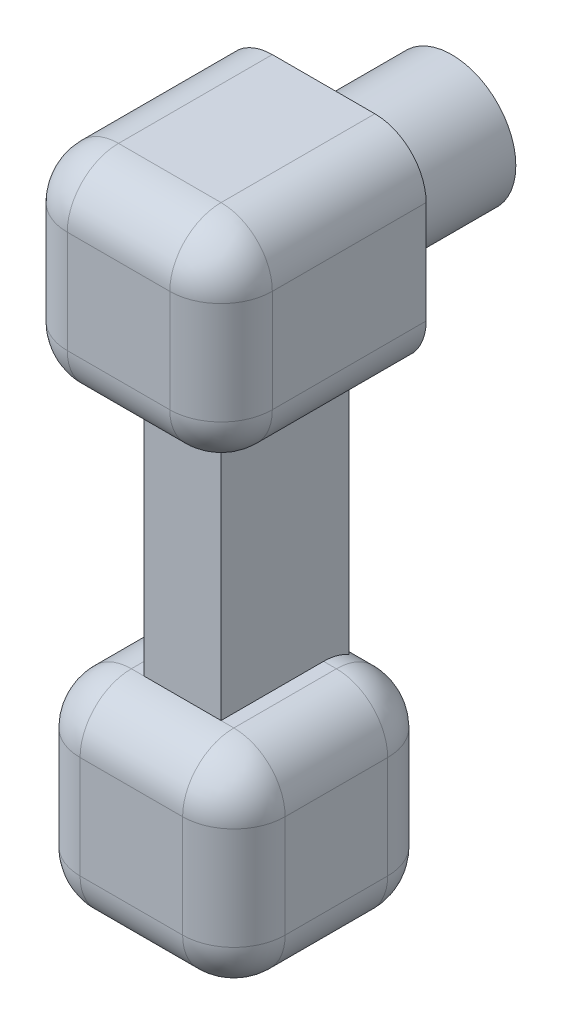
from build123d import *

# Parameters (mm, degrees)
ESQUISSE1_R             = 12.5
BOSS_EXTRU_1_DEPTH      = 25
BOSS_EXTRU_2_DEPTH      = 40
CONG_1_R                = 10
ESQUISSE5_W             = 15
ESQUISSE5_H             = 25
BOSS_EXTRU_3_DEPTH      = 50
BOSS_EXTRU_4_DEPTH      = 5
BOSS_EXTRU_4_DEPTH_BACK = 35
ESQUISSE6_W             = 40
ESQUISSE6_H             = 40
CONG_2_R                = 10
CONG_3_R                = 10
ESQUISSE8_R             = 7.5
ENL_V_MAT_EXTRU_2_DEPTH = 20
CONG_4_R                = 10


with BuildPart() as part:
    # Esquisse1 → Boss.-Extru.1 (new body)
    with BuildSketch(Plane.XY):
        Circle(ESQUISSE1_R)
    extrude(amount=BOSS_EXTRU_1_DEPTH)

    # Esquisse2 → Boss.-Extru.2 (add)
    with BuildSketch(Plane.XY.offset(25)):
        with BuildLine():
            Line((-10, 20), (10, 20))
            ThreePointArc((10, 20), (17.071067812, 17.071067812), (20, 10))
            Line((20, 10), (20, -10))
            ThreePointArc((20, -10), (17.071067812, -17.071067812), (10, -20))
            Line((10, -20), (-10, -20))
            ThreePointArc((-10, -20), (-17.071067812, -17.071067812), (-20, -10))
            Line((-20, -10), (-20, 10))
            ThreePointArc((-20, 10), (-17.071067812, 17.071067812), (-10, 20))
        make_face()
    extrude(amount=BOSS_EXTRU_2_DEPTH)

    # Congé1
    cong_1_edges = [part.edges().sort_by_distance(p)[0] for p in [
        (0, 20, 65),
        (-17.071067812, 17.071067812, 65),
        (-20, 0, 65),
        (-17.071067812, -17.071067812, 65),
        (0, -20, 65),
        (17.071067812, -17.071067812, 65),
        (20, 0, 65),
        (17.071067812, 17.071067812, 65),
    ]]
    fillet(cong_1_edges, radius=CONG_1_R)

    # Esquisse5 → Boss.-Extru.3 (add)
    with BuildSketch(Plane.XZ.offset(20)):
        with Locations((0, 40)):
            Rectangle(ESQUISSE5_W, ESQUISSE5_H)
    extrude(amount=BOSS_EXTRU_3_DEPTH)

    # Esquisse6 → Boss.-Extru.4 (add, two sides: drawn at the far end of the back side and taken through both)
    with BuildSketch(Plane(origin=(0, 0, 27.5), x_dir=(-1, 0, 0), z_dir=(0, 0, -1)).offset(-BOSS_EXTRU_4_DEPTH_BACK)):
        with Locations((0, -90)):
            Rectangle(ESQUISSE6_W, ESQUISSE6_H)
    extrude(amount=BOSS_EXTRU_4_DEPTH + BOSS_EXTRU_4_DEPTH_BACK)

    # Congé2
    cong_2_edges = [part.edges().sort_by_distance(p)[0] for p in [
        (-20, -110, 42.5),
        (0, -110, 62.5),
        (20, -110, 42.5),
        (0, -110, 22.5),
    ]]
    fillet(cong_2_edges, radius=CONG_2_R)

    # Congé3
    # the kernel refuses this fillet: 10 mm, written as the material it takes off along each edge
    with BuildSketch(Plane(origin=(10, -100, 32.5), x_dir=(1, 0, 0), z_dir=(0, 0, -1))) as cong_3_piece_1_section:
        Polygon((0, 0), (CONG_3_R, 0), (CONG_3_R, CONG_3_R), (0, CONG_3_R), align=None)
    cong_3_piece_1 = extrude(amount=CONG_3_R, mode=Mode.PRIVATE)
    cong_3_piece_1 = cong_3_piece_1 - Plane(origin=(10, -100, 32.5), x_dir=(-0.7071067811865475, 0.7071067811865475, 0), z_dir=(0, 0, -1)) * Sphere(CONG_3_R, mode=Mode.PRIVATE)
    add(cong_3_piece_1, mode=Mode.SUBTRACT)
    with BuildSketch(Plane(origin=(-10, -100, 32.5), x_dir=(0, 0, -1), z_dir=(-1, 0, 0))) as cong_3_piece_2_section:
        Polygon((0, 0), (CONG_3_R, 0), (CONG_3_R, CONG_3_R), (0, CONG_3_R), align=None)
    cong_3_piece_2 = extrude(amount=CONG_3_R, mode=Mode.PRIVATE)
    cong_3_piece_2 = cong_3_piece_2 - Plane(origin=(-10, -100, 32.5), x_dir=(0, 0.7071067811865475, 0.7071067811865475), z_dir=(-1, 0, 0)) * Sphere(CONG_3_R, mode=Mode.PRIVATE)
    add(cong_3_piece_2, mode=Mode.SUBTRACT)
    with BuildSketch(Plane(origin=(10, -100, 52.5), x_dir=(1, 0, 0), z_dir=(0, 0, 1))) as cong_3_piece_3_section:
        Polygon((0, 0), (CONG_3_R, 0), (CONG_3_R, -CONG_3_R), (0, -CONG_3_R), align=None)
    cong_3_piece_3 = extrude(amount=CONG_3_R, mode=Mode.PRIVATE)
    cong_3_piece_3 = cong_3_piece_3 - Plane(origin=(10, -100, 52.5), x_dir=(-0.7071067811865475, 0.7071067811865475, 0), z_dir=(0, 0, 1)) * Sphere(CONG_3_R, mode=Mode.PRIVATE)
    add(cong_3_piece_3, mode=Mode.SUBTRACT)
    with BuildSketch(Plane(origin=(-10, -100, 52.5), x_dir=(0, 0, 1), z_dir=(-1, 0, 0))) as cong_3_piece_4_section:
        Polygon((0, 0), (CONG_3_R, 0), (CONG_3_R, -CONG_3_R), (0, -CONG_3_R), align=None)
    cong_3_piece_4 = extrude(amount=CONG_3_R, mode=Mode.PRIVATE)
    cong_3_piece_4 = cong_3_piece_4 - Plane(origin=(-10, -100, 52.5), x_dir=(0, 0.7071067811865475, -0.7071067811865475), z_dir=(-1, 0, 0)) * Sphere(CONG_3_R, mode=Mode.PRIVATE)
    add(cong_3_piece_4, mode=Mode.SUBTRACT)
    with BuildSketch(Plane(origin=(20, -45, 62.5), x_dir=(-1, 0, 0), z_dir=(0, -1, 0)), Plane(origin=(-20, -100, 22.5), x_dir=(0, 0, 1), z_dir=(0, 1, 0))) as cong_3_piece_5:
        with BuildLine():
            CenterArc((CONG_3_R, CONG_3_R), CONG_3_R, 180, 90)
            Line((0, CONG_3_R), (0, 0))
            Line((0, 0), (CONG_3_R, 0))
        make_face()
    extrude(amount=55, mode=Mode.SUBTRACT)
    with BuildSketch(Plane(origin=(20, -45, 22.5), x_dir=(-1, 0, 0), z_dir=(0, -1, 0)), Plane(origin=(-20, -100, 62.5), x_dir=(0, 0, -1), z_dir=(0, 1, 0))) as cong_3_piece_6:
        with BuildLine():
            CenterArc((CONG_3_R, -CONG_3_R), CONG_3_R, 90, 90)
            Line((0, -CONG_3_R), (0, 0))
            Line((0, 0), (CONG_3_R, 0))
        make_face()
    extrude(amount=55, mode=Mode.SUBTRACT)

    # Esquisse8 → Enlèv. mat.-Extru.2 (cut)
    with BuildSketch(Plane(origin=(0, 0, 22.5), x_dir=(-1, 0, 0), z_dir=(0, 0, -1))):
        with Locations((0, -85)):
            Circle(ESQUISSE8_R)
    extrude(amount=-ENL_V_MAT_EXTRU_2_DEPTH, mode=Mode.SUBTRACT)

    # Congé4
    # the kernel refuses this fillet: 10 mm, written as the material it takes off along each edge
    with BuildSketch(Plane(origin=(-10, -70, 52.5), x_dir=(0, 0, 1), z_dir=(1, 0, 0))) as cong_4_piece_1:
        with BuildLine():
            CenterArc((10 - CONG_4_R, CONG_4_R), CONG_4_R, 270, 90)
            Line((10 - CONG_4_R, 0), (10, 0))
            Line((10, 0), (10, CONG_4_R))
        make_face()
    revolve(axis=Axis((-10, -70, 52.5), (0, -1, 0)), revolution_arc=90, mode=Mode.SUBTRACT)
    with BuildSketch(Plane(origin=(-10, -70, 62.5), x_dir=(0, 0, -1), z_dir=(1, 0, 0)), Plane(origin=(20, -70, 52.5), x_dir=(-1, 0, 0), z_dir=(0, 0, -1))) as cong_4_piece_2:
        with BuildLine():
            CenterArc((CONG_4_R, -CONG_4_R), CONG_4_R, 90, 90)
            Line((0, -CONG_4_R), (0, 0))
            Line((0, 0), (CONG_4_R, 0))
        make_face()
    extrude(amount=20, mode=Mode.SUBTRACT)
    with BuildSketch(Plane(origin=(10, -70, 52.5), x_dir=(0, 0, 1), z_dir=(-1, 0, 0))) as cong_4_piece_3:
        with BuildLine():
            CenterArc((10 - CONG_4_R, -CONG_4_R), CONG_4_R, 0, 90)
            Line((10, -CONG_4_R), (10, 0))
            Line((10, 0), (10 - CONG_4_R, 0))
        make_face()
    revolve(axis=Axis((10, -70, 52.5), (0, 1, 0)), revolution_arc=90, mode=Mode.SUBTRACT)
    with BuildSketch(Plane(origin=(10, -70, 32.5), x_dir=(1, 0, 0), z_dir=(0, 0, 1))) as cong_4_piece_4:
        with BuildLine():
            CenterArc((10 - CONG_4_R, -CONG_4_R), CONG_4_R, 0, 90)
            Line((10, -CONG_4_R), (10, 0))
            Line((10, 0), (10 - CONG_4_R, 0))
        make_face()
    revolve(axis=Axis((10, -70, 32.5), (0, 1, 0)), revolution_arc=90, mode=Mode.SUBTRACT)
    with BuildSketch(Plane(origin=(-10, -70, 22.5), x_dir=(0, 0, 1), z_dir=(1, 0, 0))) as cong_4_piece_5_section:
        with BuildLine():
            CenterArc((CONG_4_R, CONG_4_R), CONG_4_R, 180, 90)
            Line((0, CONG_4_R), (0, 0))
            Line((0, 0), (CONG_4_R, 0))
        make_face()
    cong_4_piece_5 = extrude(amount=20, mode=Mode.PRIVATE)
    cong_4_piece_5 = split(cong_4_piece_5, bisect_by=Plane(origin=(-8.75, -70.240083817, 27.5), z_dir=(0, 0, 1)), keep=Keep.TOP, mode=Mode.PRIVATE)
    cong_4_piece_5 = split(cong_4_piece_5, bisect_by=Plane(origin=(-7.5, -70.240083817, 29.132507845), z_dir=(-1, 0, 0)), keep=Keep.TOP, mode=Mode.PRIVATE)
    add(cong_4_piece_5, mode=Mode.SUBTRACT)
    with BuildSketch(Plane(origin=(-10, -70, 22.5), x_dir=(0, 0, 1), z_dir=(1, 0, 0))) as cong_4_piece_6_section:
        with BuildLine():
            CenterArc((CONG_4_R, CONG_4_R), CONG_4_R, 180, 90)
            Line((0, CONG_4_R), (0, 0))
            Line((0, 0), (CONG_4_R, 0))
        make_face()
    cong_4_piece_6 = extrude(amount=20, mode=Mode.PRIVATE)
    cong_4_piece_6 = split(cong_4_piece_6, bisect_by=Plane(origin=(-8.75, -72.5512006, 27.5), z_dir=(0, 0, -1)), keep=Keep.TOP, mode=Mode.PRIVATE)
    cong_4_piece_6 = split(cong_4_piece_6, bisect_by=Plane(origin=(-7.5, -72.5512006, 24.143917643), z_dir=(-1, 0, 0)), keep=Keep.TOP, mode=Mode.PRIVATE)
    add(cong_4_piece_6, mode=Mode.SUBTRACT)
    with BuildSketch(Plane(origin=(-10, -70, 22.5), x_dir=(0, 0, 1), z_dir=(1, 0, 0))) as cong_4_piece_7_section:
        with BuildLine():
            CenterArc((CONG_4_R, CONG_4_R), CONG_4_R, 180, 90)
            Line((0, CONG_4_R), (0, 0))
            Line((0, 0), (CONG_4_R, 0))
        make_face()
    cong_4_piece_7 = extrude(amount=20, mode=Mode.PRIVATE)
    cong_4_piece_7 = split(cong_4_piece_7, bisect_by=Plane(origin=(0, -72.5512006, 27.5), z_dir=(0, 0, -1)), keep=Keep.TOP, mode=Mode.PRIVATE)
    cong_4_piece_7 = split(cong_4_piece_7, bisect_by=Plane(origin=(7.5, -72.5512006, 24.143917643), z_dir=(-1, 0, 0)), keep=Keep.TOP, mode=Mode.PRIVATE)
    cong_4_piece_7 = split(cong_4_piece_7, bisect_by=Plane(origin=(-7.5, -72.5512006, 24.143917643), z_dir=(1, 0, 0)), keep=Keep.TOP, mode=Mode.PRIVATE)
    add(cong_4_piece_7, mode=Mode.SUBTRACT)
    with BuildSketch(Plane(origin=(-10, -70, 22.5), x_dir=(0, 0, 1), z_dir=(1, 0, 0))) as cong_4_piece_8_section:
        with BuildLine():
            CenterArc((CONG_4_R, CONG_4_R), CONG_4_R, 180, 90)
            Line((0, CONG_4_R), (0, 0))
            Line((0, 0), (CONG_4_R, 0))
        make_face()
    cong_4_piece_8 = extrude(amount=20, mode=Mode.PRIVATE)
    cong_4_piece_8 = split(cong_4_piece_8, bisect_by=Plane(origin=(8.75, -70.240083817, 27.5), z_dir=(0, 0, 1)), keep=Keep.TOP, mode=Mode.PRIVATE)
    cong_4_piece_8 = split(cong_4_piece_8, bisect_by=Plane(origin=(7.5, -70.240083817, 29.132507845), z_dir=(1, 0, 0)), keep=Keep.TOP, mode=Mode.PRIVATE)
    add(cong_4_piece_8, mode=Mode.SUBTRACT)
    with BuildSketch(Plane(origin=(-10, -70, 22.5), x_dir=(0, 0, 1), z_dir=(1, 0, 0))) as cong_4_piece_9_section:
        with BuildLine():
            CenterArc((CONG_4_R, CONG_4_R), CONG_4_R, 180, 90)
            Line((0, CONG_4_R), (0, 0))
            Line((0, 0), (CONG_4_R, 0))
        make_face()
    cong_4_piece_9 = extrude(amount=20, mode=Mode.PRIVATE)
    cong_4_piece_9 = split(cong_4_piece_9, bisect_by=Plane(origin=(8.75, -72.5512006, 27.5), z_dir=(0, 0, -1)), keep=Keep.TOP, mode=Mode.PRIVATE)
    cong_4_piece_9 = split(cong_4_piece_9, bisect_by=Plane(origin=(7.5, -72.5512006, 24.143917643), z_dir=(1, 0, 0)), keep=Keep.TOP, mode=Mode.PRIVATE)
    add(cong_4_piece_9, mode=Mode.SUBTRACT)
    with BuildSketch(Plane(origin=(-10, -70, 32.5), x_dir=(-1, 0, 0), z_dir=(0, 0, 1))) as cong_4_piece_10:
        with BuildLine():
            CenterArc((10 - CONG_4_R, CONG_4_R), CONG_4_R, 270, 90)
            Line((10, CONG_4_R), (10, 0))
            Line((10, 0), (10 - CONG_4_R, 0))
        make_face()
    revolve(axis=Axis((-10, -70, 32.5), (0, -1, 0)), revolution_arc=90, mode=Mode.SUBTRACT)
    with BuildSketch(Plane(origin=(-20, -70, 32.5), x_dir=(0, -1, 0), z_dir=(0, 0, 1))) as cong_4_piece_11:
        with BuildLine():
            CenterArc((CONG_4_R, CONG_4_R), CONG_4_R, 180, 90)
            Line((0, CONG_4_R), (0, 0))
            Line((0, 0), (CONG_4_R, 0))
        make_face()
    extrude(amount=20, mode=Mode.SUBTRACT)


solid = part.part
